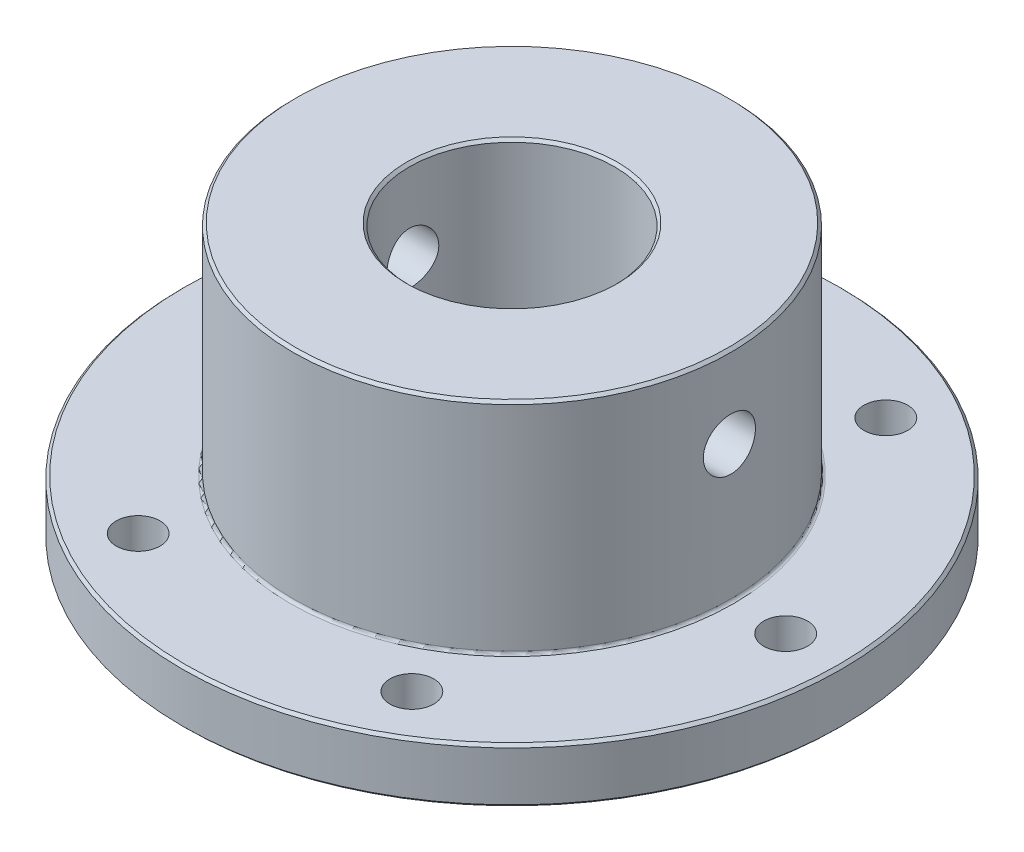
from build123d import *

# Parameters (mm, degrees)
CROQUIS1_R                 = 60.239614391
CROQUIS1_R_2               = 18.75
CROQUIS1_R_3               = 4
SALIENTE_EXTRUIR1_DEPTH    = 10
CROQUIS2_R                 = 40
CROQUIS2_R_2               = 18.75
SALIENTE_EXTRUIR2_DEPTH    = 40
CHAFL_N2_SIZE              = 0.5
REDONDEO1_R                = 0.5
CORTAR_EXTRUIR1_DEPTH      = 99.780677685
CORTAR_EXTRUIR1_DEPTH_BACK = 99.780677685
CROQUIS3_R                 = 4.7625


with BuildPart() as part:
    # Croquis1 → Saliente-Extruir1 (new body)
    with BuildSketch(Plane(origin=(0, 0, 0), x_dir=(1, 0, 0), z_dir=(0, 1, 0))):
        Circle(CROQUIS1_R)
        Circle(CROQUIS1_R_2, mode=Mode.SUBTRACT)
        with Locations((25, -43.301270189)):
            Circle(CROQUIS1_R_3, mode=Mode.SUBTRACT)
        with Locations((-25, -43.301270189)):
            Circle(CROQUIS1_R_3, mode=Mode.SUBTRACT)
        with Locations((-50, 0)):
            Circle(CROQUIS1_R_3, mode=Mode.SUBTRACT)
        with Locations((-25, 43.301270189)):
            Circle(CROQUIS1_R_3, mode=Mode.SUBTRACT)
        with Locations((25, 43.301270189)):
            Circle(CROQUIS1_R_3, mode=Mode.SUBTRACT)
        with Locations((50, 0)):
            Circle(CROQUIS1_R_3, mode=Mode.SUBTRACT)
    extrude(amount=SALIENTE_EXTRUIR1_DEPTH)

    # Croquis2 → Saliente-Extruir2 (add)
    with BuildSketch(Plane(origin=(0, 10, 0), x_dir=(1, 0, 0), z_dir=(0, 1, 0))):
        Circle(CROQUIS2_R)
        Circle(CROQUIS2_R_2, mode=Mode.SUBTRACT)
    extrude(amount=SALIENTE_EXTRUIR2_DEPTH)

    # Chaflán2
    chafl_n2_edges = [part.edges().sort_by_distance(p)[0] for p in [
        (-60.239614391, 10, 0),
        (-60.239614391, 0, 0),
        (-40, 50, 0),
        (-18.75, 50, 0),
    ]]
    chamfer(chafl_n2_edges, length=CHAFL_N2_SIZE)

    # Redondeo1
    redondeo1_edges = [part.edges().sort_by_distance(p)[0] for p in [
        (-40, 10, 0),
    ]]
    fillet(redondeo1_edges, radius=REDONDEO1_R)

    # Croquis3 → Cortar-Extruir1 (cut, two sides: drawn at the far end of the back side and taken through both)
    with BuildSketch(Plane(origin=(0, 0, 0), x_dir=(0, 0, -1), z_dir=(1, 0, 0)).offset(-CORTAR_EXTRUIR1_DEPTH_BACK)):
        with Locations((0, 35)):
            Circle(CROQUIS3_R)
    extrude(amount=CORTAR_EXTRUIR1_DEPTH + CORTAR_EXTRUIR1_DEPTH_BACK, mode=Mode.SUBTRACT)


solid = part.part
